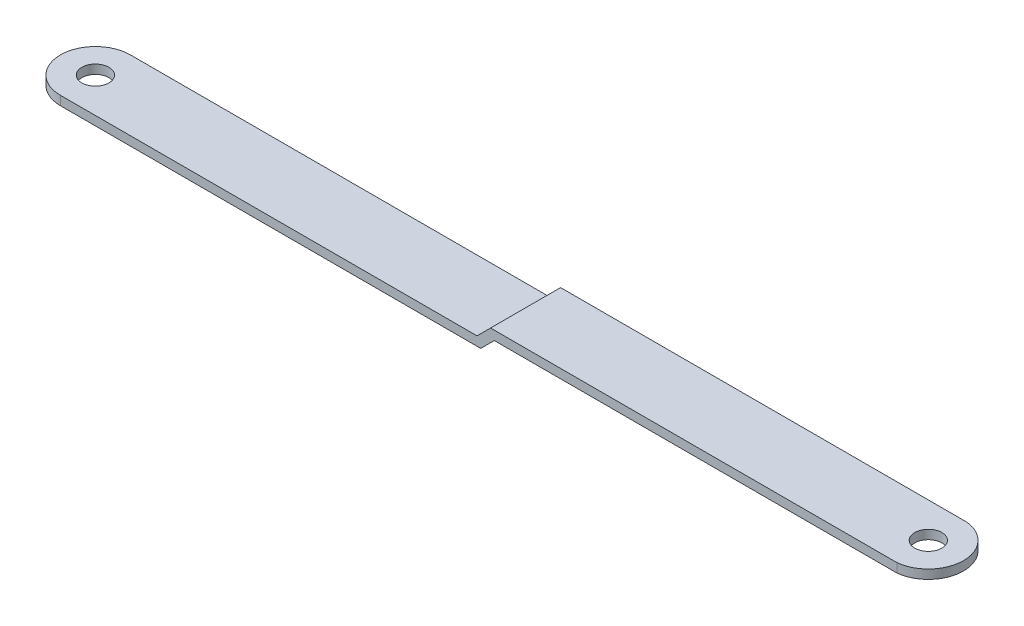
from build123d import *

# Parameters (mm, degrees)
EXTRUDE_1_DEPTH     = 15.5
SKETCH_2_OUTSIDE_W  = 242.132
SKETCH_2_OUTSIDE_H  = 57.632
SKETCH_2_OUTSIDE_R  = 3
CUT_EXTRUDE_4_DEPTH = 10


with BuildPart() as part:
    # Эскиз1 → Вытянуть-Тонкостенный1 (new body)
    with BuildSketch(Plane.XY):
        Polygon((0, 0), (100, 0), (103, 3), (200, 3), (200, 1), (103.828427125, 1), (100.828427125, -2), (0, -2), align=None)
    extrude(amount=EXTRUDE_1_DEPTH)

    # Эскиз2 outside → Вырез-Вытянуть4 (cut)
    # profile 1 of 3: a face of its own
    with BuildSketch(Plane(origin=(0, 3, 0), x_dir=(1, 0, 0), z_dir=(0, 1, 0))):
        with Locations((100, -7.75)):
            Rectangle(SKETCH_2_OUTSIDE_W, SKETCH_2_OUTSIDE_H)
        with BuildLine():
            Line((192.956019966, 0), (7.75, 0))
            ThreePointArc((7.75, 0), (0, -7.75), (7.75, -15.5))
            Line((7.75, -15.5), (192.956019966, -15.5))
            ThreePointArc((192.956019966, -15.5), (199.971814281, -7.75), (192.956019966, 0))
        make_face(mode=Mode.SUBTRACT)
    # profile 2 of 3: a face of its own
    with BuildSketch(Plane(origin=(0, 3, 0), x_dir=(1, 0, 0), z_dir=(0, 1, 0))):
        with Locations((192.183396821, -7.75)):
            Circle(SKETCH_2_OUTSIDE_R)
    # profile 3 of 3: a face of its own
    with BuildSketch(Plane(origin=(0, 3, 0), x_dir=(1, 0, 0), z_dir=(0, 1, 0))):
        with Locations((7.75, -7.75)):
            Circle(SKETCH_2_OUTSIDE_R)
    extrude(amount=-CUT_EXTRUDE_4_DEPTH, mode=Mode.SUBTRACT)


solid = part.part
